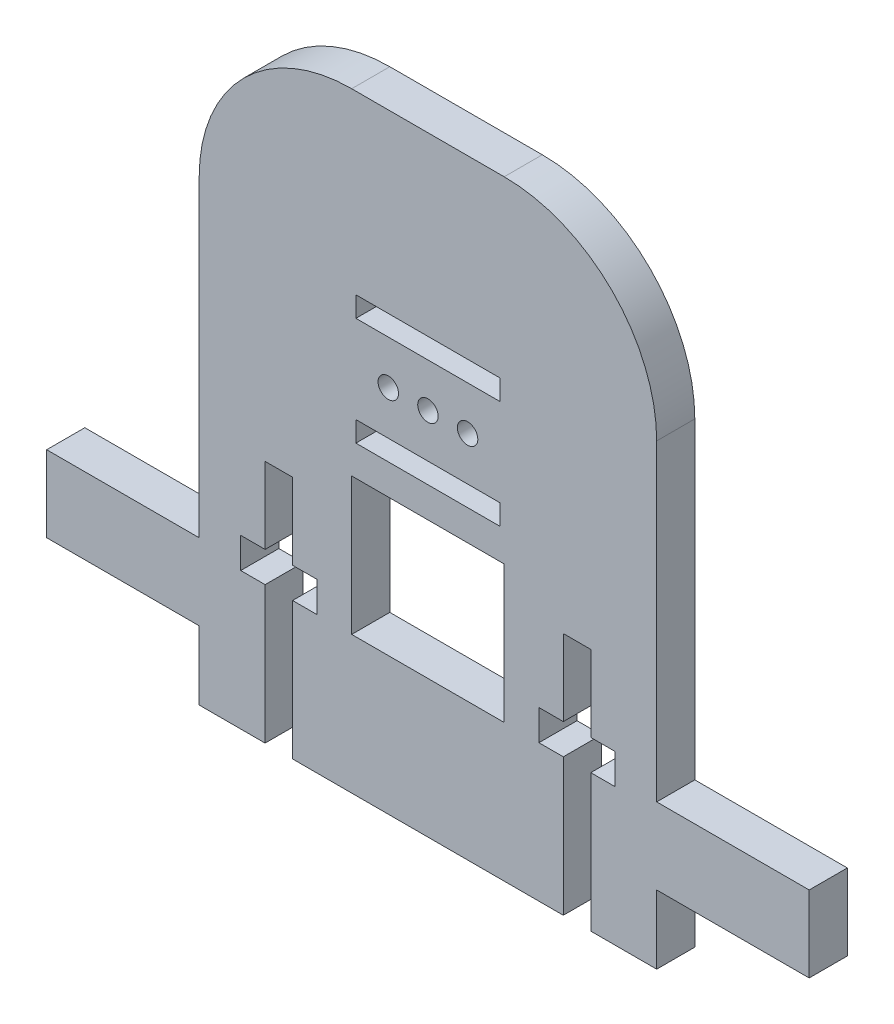
from build123d import *

# Parameters (mm, degrees)
BOSS_EXTRUDE1_DEPTH = 3.175
FILLET1_R           = 12.7
SKETCH2_R           = 0.85
SKETCH2_W           = 12
SKETCH2_H           = 1.7
CUT_EXTRUDE1_DEPTH  = 41.783613437
SKETCH3_W           = 2.286
SKETCH3_H           = 20.32
SKETCH3_W_2         = 12.7
SKETCH3_H_2         = 11.43
SKETCH3_W_3         = 6.35
SKETCH3_H_3         = 2.54
CUT_EXTRUDE2_DEPTH  = 41.783613437


with BuildPart() as part:
    # Sketch1 → Boss-Extrude1 (new body)
    with BuildSketch(Plane.XY):
        Polygon((19.05, -25.4), (-19.05, -25.4), (-19.05, -19.685), (-31.75, -19.685), (-31.75, -13.335), (-19.05, -13.335), (-19.05, 25.4), (19.05, 25.4), (19.05, -13.335), (31.75, -13.335), (31.75, -19.685), (19.05, -19.685), align=None)
    extrude(amount=BOSS_EXTRUDE1_DEPTH)

    # Fillet1
    fillet1_edges = [part.edges().sort_by_distance(p)[0] for p in [
        (19.05, 25.4, 1.5875),
        (-19.05, 25.4, 1.5875),
    ]]
    fillet(fillet1_edges, radius=FILLET1_R)

    # Sketch2 → Cut-Extrude1 (cut, through all)
    with BuildSketch(Plane.XY):
        with Locations((0, 5.364988)):
            Circle(SKETCH2_R)
        with Locations((-3.302, 5.364988)):
            Circle(SKETCH2_R)
        with Locations((3.302, 5.364988)):
            Circle(SKETCH2_R)
        with Locations((0, 0.864988)):
            Rectangle(SKETCH2_W, SKETCH2_H)
        with Locations((0, 9.864988)):
            Rectangle(SKETCH2_W, SKETCH2_H)
    extrude(amount=CUT_EXTRUDE1_DEPTH, mode=Mode.SUBTRACT)

    # Sketch3 → Cut-Extrude2 (cut, through all)
    with BuildSketch(Plane.XY):
        with Locations((-12.4167697, -15.24)):
            Rectangle(SKETCH3_W, SKETCH3_H)
        with Locations((0, -8.240012)):
            Rectangle(SKETCH3_W_2, SKETCH3_H_2)
        with Locations((-12.4167697, -12.7)):
            Rectangle(SKETCH3_W_3, SKETCH3_H_3)
        with Locations((12.4167697, -12.7)):
            Rectangle(SKETCH3_W_3, SKETCH3_H_3)
        with Locations((12.4167697, -15.24)):
            Rectangle(SKETCH3_W, SKETCH3_H)
    extrude(amount=CUT_EXTRUDE2_DEPTH, mode=Mode.SUBTRACT)


solid = part.part
